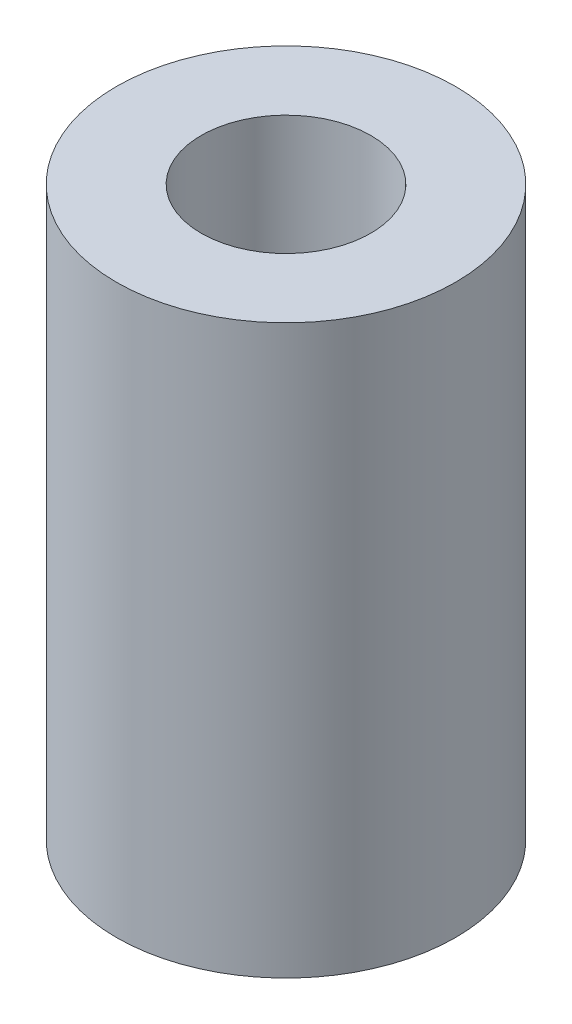
from build123d import *

# Parameters (mm, degrees)
SKETCH1_R           = 4.5
SKETCH1_R_2         = 2.25
BOSS_EXTRUDE1_DEPTH = 15.06


with BuildPart() as part:
    # Sketch1 → Boss-Extrude1 (new body)
    with BuildSketch(Plane(origin=(0, 0, 0), x_dir=(1, 0, 0), z_dir=(0, 1, 0))):
        Circle(SKETCH1_R)
        Circle(SKETCH1_R_2, mode=Mode.SUBTRACT)
    extrude(amount=BOSS_EXTRUDE1_DEPTH)


solid = part.part
